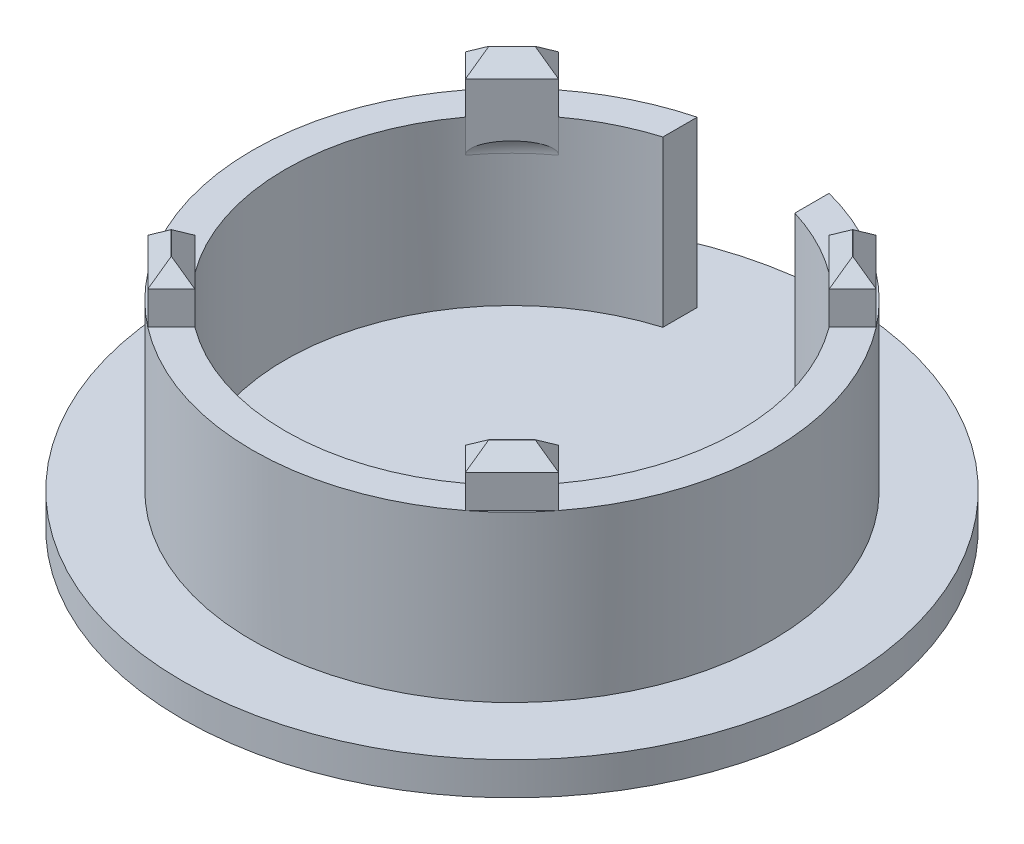
from build123d import *

# Parameters (mm, degrees)
SKETCH1_R           = 20.0025
SKETCH1_R_2         = 17.4625
BOSS_EXTRUDE1_DEPTH = 12.7
BOSS_EXTRUDE2_DEPTH = 3.81
FILLET1_R           = 2.54
CUT_EXTRUDE1_REACH  = 33.008
SKETCH3_W           = 10.16
SKETCH3_H           = 5.08
SKETCH5_R           = 25.4
BOSS_EXTRUDE3_DEPTH = 2.54
CHAMFER1_SIZE       = 1.27
CUT_EXTRUDE2_DEPTH  = 0.635


with BuildPart() as part:
    # Sketch1 → Boss-Extrude1 (new body)
    with BuildSketch(Plane(origin=(0, 0, 0), x_dir=(1, 0, 0), z_dir=(0, 1, 0))):
        with Locations(Location((0, 0, 0), (0, 0, 270))):
            Circle(SKETCH1_R)
        with Locations(Location((0, 0, 0), (0, 0, 270))):
            Circle(SKETCH1_R_2, mode=Mode.SUBTRACT)
    extrude(amount=BOSS_EXTRUDE1_DEPTH)

    # Sketch2 → Boss-Extrude2 (add)
    with BuildSketch(Plane(origin=(0, 12.7, 0), x_dir=(1, 0, 0), z_dir=(0, 1, 0))):
        Polygon((-14.012583184, 10.420480736), (-10.420480736, 14.012583184), (-12.233353721, 15.82545617), (-15.82545617, 12.233353721), align=None)
        Polygon((15.82545617, 12.233353721), (12.233353721, 15.82545617), (10.420480736, 14.012583184), (14.012583184, 10.420480736), align=None)
        Polygon((14.012583184, -10.420480736), (15.82545617, -12.233353721), (12.233353721, -15.82545617), (10.420480736, -14.012583184), align=None)
        Polygon((-10.420480736, -14.012583184), (-12.233353721, -15.82545617), (-15.82545617, -12.233353721), (-14.012583184, -10.420480736), align=None)
    extrude(amount=BOSS_EXTRUDE2_DEPTH)

    # Fillet1
    # the kernel refuses this fillet: 2.54 mm, written as the material it adds along each edge
    with BuildSketch(Plane(origin=(0, 12.7, 0), x_dir=(0.9622119092251143, 0, -0.27230174759879905), z_dir=(0.27230174759879905, 0, 0.9622119092251143))) as fillet1_piece_1_section:
        with BuildLine():
            CenterArc((17.4625 - FILLET1_R, -FILLET1_R), FILLET1_R, 0, 90)
            Line((17.4625 - FILLET1_R, 0), (17.4625, 0))
            Line((17.4625, 0), (17.4625, -FILLET1_R))
        make_face()
    fillet1_piece_1 = revolve(axis=Axis((0, 12.7, 0), (0, 1, 0)), revolution_arc=58.397439468, mode=Mode.PRIVATE)
    fillet1_piece_1 = split(fillet1_piece_1, bisect_by=Plane(origin=(12.216531698, 11.701072116, -12.216532222), z_dir=(0.7071067811865495, 0, -0.7071067811865456)), keep=Keep.TOP, mode=Mode.PRIVATE)
    add(fillet1_piece_1)
    with BuildSketch(Plane(origin=(0, 12.7, 0), x_dir=(0.27230174759880327, 0, 0.9622119092251133), z_dir=(-0.9622119092251133, 0, 0.27230174759880327))) as fillet1_piece_2_section:
        with BuildLine():
            CenterArc((17.4625 - FILLET1_R, -FILLET1_R), FILLET1_R, 0, 90)
            Line((17.4625 - FILLET1_R, 0), (17.4625, 0))
            Line((17.4625, 0), (17.4625, -FILLET1_R))
        make_face()
    fillet1_piece_2 = revolve(axis=Axis((0, 12.7, 0), (0, 1, 0)), revolution_arc=58.397439468, mode=Mode.PRIVATE)
    fillet1_piece_2 = split(fillet1_piece_2, bisect_by=Plane(origin=(12.216532222, 11.701072116, 12.216531698), z_dir=(0.7071067811865495, 0, 0.7071067811865456)), keep=Keep.TOP, mode=Mode.PRIVATE)
    add(fillet1_piece_2)
    with BuildSketch(Plane(origin=(0, 12.7, 0), x_dir=(-0.9622119092251141, 0, 0.2723017475987997), z_dir=(-0.2723017475987997, 0, -0.9622119092251141))) as fillet1_piece_3_section:
        with BuildLine():
            CenterArc((17.4625 - FILLET1_R, -FILLET1_R), FILLET1_R, 0, 90)
            Line((17.4625 - FILLET1_R, 0), (17.4625, 0))
            Line((17.4625, 0), (17.4625, -FILLET1_R))
        make_face()
    fillet1_piece_3 = revolve(axis=Axis((0, 12.7, 0), (0, 1, 0)), revolution_arc=58.397439468, mode=Mode.PRIVATE)
    fillet1_piece_3 = split(fillet1_piece_3, bisect_by=Plane(origin=(-12.216531698, 11.701072116, 12.216532222), z_dir=(-0.7071067811865488, 0, 0.7071067811865464)), keep=Keep.TOP, mode=Mode.PRIVATE)
    add(fillet1_piece_3)
    with BuildSketch(Plane(origin=(0, 12.7, 0), x_dir=(-0.27230174759880277, 0, -0.9622119092251133), z_dir=(0.9622119092251133, 0, -0.27230174759880277))) as fillet1_piece_4_section:
        with BuildLine():
            CenterArc((17.4625 - FILLET1_R, -FILLET1_R), FILLET1_R, 0, 90)
            Line((17.4625 - FILLET1_R, 0), (17.4625, 0))
            Line((17.4625, 0), (17.4625, -FILLET1_R))
        make_face()
    fillet1_piece_4 = revolve(axis=Axis((0, 12.7, 0), (0, 1, 0)), revolution_arc=58.397439468, mode=Mode.PRIVATE)
    fillet1_piece_4 = split(fillet1_piece_4, bisect_by=Plane(origin=(-12.216532222, 11.701072116, -12.216531698), z_dir=(-0.7071067811865489, 0, -0.7071067811865461)), keep=Keep.TOP, mode=Mode.PRIVATE)
    add(fillet1_piece_4)

    # Sketch3 → Cut-Extrude1 (cut, up to next)
    with BuildSketch(Plane(origin=(0, 12.7, 0), x_dir=(1, 0, 0), z_dir=(0, 1, 0)), mode=Mode.PRIVATE) as cut_extrude1_sk1:
        with Locations((0, 17.4625)):
            Rectangle(SKETCH3_W, SKETCH3_H)
    cut_extrude1_tool1 = extrude(cut_extrude1_sk1.sketch, amount=-CUT_EXTRUDE1_REACH, mode=Mode.PRIVATE) & part.part
    add(cut_extrude1_tool1.solids().sort_by_distance((0, 12.7, -17.4625))[0], mode=Mode.SUBTRACT)

    # Sketch5 → Boss-Extrude3 (add)
    with BuildSketch(Plane.XZ):
        with Locations(Location((0, 0, 0), (0, 0, 270))):
            Circle(SKETCH5_R)
    extrude(amount=BOSS_EXTRUDE3_DEPTH)

    # Chamfer1
    chamfer1_edges = [part.edges().sort_by_distance(p)[0] for p in [
        (14.919019677, 16.51, -11.326917228),
        (14.029404946, 16.51, -14.029404946),
        (11.326917228, 16.51, -14.919019677),
        (12.21653196, 16.51, -12.21653196),
        (-14.919019677, 16.51, -11.326917228),
        (-12.21653196, 16.51, -12.21653196),
        (-11.326917228, 16.51, -14.919019677),
        (-14.029404946, 16.51, -14.029404946),
        (12.21653196, 16.51, 12.21653196),
        (11.326917228, 16.51, 14.919019677),
        (14.029404946, 16.51, 14.029404946),
        (14.919019677, 16.51, 11.326917228),
        (-12.21653196, 16.51, 12.21653196),
        (-14.919019677, 16.51, 11.326917228),
        (-14.029404946, 16.51, 14.029404946),
        (-11.326917228, 16.51, 14.919019677),
    ]]
    chamfer(chamfer1_edges, length=CHAMFER1_SIZE)

    # Sketch6 → Cut-Extrude2 (cut)
    # profile 1 of 9: a face of its own
    with BuildSketch(Plane.XZ.offset(2.54)):
        with BuildLine():
            add(Edge.make_bspline(
                [(-17.032499249, 1.319443002), (-17.03403865, 1.389061904), (-17.037061575, 1.525772652), (-17.059184217, 1.725487552), (-17.095406326, 1.915378659), (-17.145156597, 2.095449841), (-17.211366628, 2.265164031), (-17.292045507, 2.424860277), (-17.385797694, 2.575408719), (-17.496159227, 2.713538284), (-17.620162613, 2.840375461), (-17.761611267, 2.949966524), (-17.918509595, 3.043791119), (-18.090284222, 3.121408569), (-18.278741591, 3.180033156), (-18.481079289, 3.225217959), (-18.699659745, 3.25396588), (-18.850505045, 3.258915542), (-18.928463436, 3.261473577)],
                knots=[0, 0, 0, 0, 1.085004295, 2.130624628, 3.127502488, 4.095591988, 5.038265407, 5.961928981, 6.881004956, 7.797361512, 8.712515032, 9.639410376, 10.577828775, 11.556244546, 12.569940987, 13.648583667, 14.78476404, 16, 16, 16, 16], degree=3))
            add(Edge.make_bspline(
                [(-18.928463436, 3.261473577), (-19.009428359, 3.259898161), (-19.171051085, 3.256753306), (-19.412618116, 3.22620294), (-19.651048232, 3.173968594), (-19.886633931, 3.103712378), (-20.114904105, 3.010869486), (-20.330143531, 2.889926916), (-20.535568165, 2.748731127), (-20.657969705, 2.634973073), (-20.7198862, 2.577428862)],
                knots=[0, 0, 0, 0, 0.987469591, 1.971193459, 2.964671202, 3.962631321, 4.967592825, 5.96377071, 6.969978801, 8, 8, 8, 8], degree=3))
            add(Edge.make_bspline(
                [(-20.7198862, 2.577428862), (-20.780569283, 2.504298842), (-20.902901592, 2.356874489), (-21.056113266, 2.109432817), (-21.184605524, 1.839944722), (-21.269821, 1.59822326), (-21.330522265, 1.392288301), (-21.3757325, 1.225752766), (-21.419416187, 1.048315288), (-21.463028712, 0.860236224), (-21.507304921, 0.661632971), (-21.549251866, 0.452310653), (-21.592563156, 0.232674257), (-21.618890889, 0.082223801), (-21.632376037, 0.005162602)],
                knots=[0, 0, 0, 0, 1.236008724, 2.491696123, 3.776879683, 5.116281345, 5.823362495, 6.57201389, 7.362629052, 8.202256904, 9.085583543, 10.011580638, 10.981525319, 12, 12, 12, 12], degree=3))
            add(Edge.make_bspline(
                [(-21.632376037, 0.005162602), (-21.649619068, -0.082948011), (-21.68236184, -0.250261149), (-21.721959716, -0.490586411), (-21.754928731, -0.706017827), (-21.777870881, -0.898946693), (-21.79567817, -1.069722058), (-21.804610384, -1.221794959), (-21.81435313, -1.355064604), (-21.814356289, -1.438200023), (-21.814357745, -1.476504065)],
                knots=[0, 0, 0, 0, 1.44127866, 2.736842362, 3.909953624, 4.939685167, 5.855787046, 6.665763779, 7.385260328, 8, 8, 8, 8], degree=3))
            add(Edge.make_bspline(
                [(-21.814357745, -1.476504065), (-21.812665587, -1.540280885), (-21.809346987, -1.665357723), (-21.782028431, -1.847856866), (-21.742993307, -2.0218846), (-21.686640859, -2.186220068), (-21.617860324, -2.342574851), (-21.52945119, -2.487457156), (-21.429379248, -2.625207301), (-21.312501158, -2.75157707), (-21.182702092, -2.866886697), (-21.037980528, -2.96659435), (-20.880889438, -3.052044478), (-20.711076977, -3.123323554), (-20.528476283, -3.178549507), (-20.333133892, -3.218166493), (-20.125557957, -3.244197572), (-19.98257141, -3.249648153), (-19.909357745, -3.252439024)],
                knots=[0, 0, 0, 0, 1.043586486, 2.046644819, 3.015385727, 3.959777502, 4.886618628, 5.805854748, 6.732802919, 7.669970395, 8.618136816, 9.569645907, 10.540433057, 11.541139376, 12.579411923, 13.658246277, 14.800947521, 16, 16, 16, 16], degree=3))
            add(Edge.make_bspline(
                [(-19.909357745, -3.252439024), (-19.839601295, -3.251429406), (-19.701450676, -3.249429885), (-19.497849111, -3.226568937), (-19.300115063, -3.190716508), (-19.109094414, -3.139395566), (-18.925121719, -3.071495745), (-18.747351629, -2.990243315), (-18.576468668, -2.892878614), (-18.412299902, -2.780388698), (-18.255813402, -2.652784166), (-18.1097056, -2.508650731), (-17.972812259, -2.349061838), (-17.848990483, -2.171406666), (-17.731565928, -1.979893812), (-17.626560778, -1.771438122), (-17.530048885, -1.547541882), (-17.476692785, -1.390437157), (-17.44937807, -1.310010163)],
                knots=[0, 0, 0, 0, 0.989643029, 1.959959244, 2.903686927, 3.839798661, 4.763158309, 5.683889659, 6.610896296, 7.550863383, 8.505471603, 9.472651208, 10.46012564, 11.485097357, 12.542758083, 13.645985729, 14.794903902, 16, 16, 16, 16], degree=3))
            Line((-17.44937807, -1.310010163), (-18.642448247, -1.309011925))
            add(Edge.make_bspline(
                [(-18.642448247, -1.309011925), (-18.6657257, -1.371522969), (-18.711936412, -1.49562073), (-18.807720068, -1.669692017), (-18.923447123, -1.830790799), (-19.036016621, -1.953732199), (-19.135891079, -2.042411814), (-19.216815468, -2.10212279), (-19.304819326, -2.149984803), (-19.397301384, -2.192212411), (-19.495010012, -2.225414007), (-19.59861909, -2.250459008), (-19.707617868, -2.265437385), (-19.782402979, -2.269490608), (-19.820302867, -2.271544715)],
                knots=[0, 0, 0, 0, 1.473040331, 2.924299426, 4.375932429, 5.849949031, 6.597906125, 7.326505657, 8.067354521, 8.808020226, 9.571951013, 10.344710941, 11.161126197, 12, 12, 12, 12], degree=3))
            add(Edge.make_bspline(
                [(-19.820302867, -2.271544715), (-19.879094274, -2.268563702), (-19.993253015, -2.262775293), (-20.155890908, -2.21812569), (-20.301319936, -2.143947436), (-20.429216243, -2.04298274), (-20.533656064, -1.913574185), (-20.609650722, -1.758042242), (-20.656138574, -1.57848147), (-20.663247774, -1.450550674), (-20.666969533, -1.383577236)],
                knots=[0, 0, 0, 0, 1.021781972, 1.984054262, 2.907838959, 3.845226274, 4.797816657, 5.775134162, 6.835253762, 8, 8, 8, 8], degree=3))
            add(Edge.make_bspline(
                [(-20.666969533, -1.383577236), (-20.666094088, -1.339675553), (-20.664255338, -1.247466172), (-20.652658744, -1.102069492), (-20.637746871, -0.942317047), (-20.606967367, -0.705521046), (-20.558582036, -0.387774591), (-20.512660034, -0.128969689), (-20.488859777, 0.005162602)],
                knots=[0, 0, 0, 0, 0.56382053, 1.184226618, 1.872559965, 2.62436128, 4.250488501, 6, 6, 6, 6], degree=3))
            add(Edge.make_bspline(
                [(-20.488859777, 0.005162602), (-20.475745913, 0.075761551), (-20.450366378, 0.212393165), (-20.409954223, 0.409708658), (-20.371552898, 0.59262623), (-20.334033177, 0.761359711), (-20.297318627, 0.915599467), (-20.259046995, 1.05553357), (-20.224056513, 1.181666084), (-20.17666921, 1.325890507), (-20.117704038, 1.484431336), (-20.03882097, 1.650839428), (-19.956192415, 1.79166794), (-19.888178373, 1.867181782), (-19.856441078, 1.902418699)],
                knots=[0, 0, 0, 0, 1.278184275, 2.473696614, 3.585163994, 4.605199634, 5.550637581, 6.407020795, 7.187555592, 7.880188226, 9.109059753, 10.194931009, 11.157703224, 12, 12, 12, 12], degree=3))
            add(Edge.make_bspline(
                [(-19.856441078, 1.902418699), (-19.828885232, 1.930371703), (-19.774100011, 1.985946534), (-19.685839955, 2.060852632), (-19.591104096, 2.124140905), (-19.493111816, 2.181254853), (-19.385850069, 2.225126107), (-19.269523235, 2.257868392), (-19.142491244, 2.277152947), (-19.054153755, 2.279411572), (-19.008483761, 2.280579268)],
                knots=[0, 0, 0, 0, 0.983174765, 1.954701254, 2.893388149, 3.834546902, 4.791313645, 5.787692279, 6.85624912, 8, 8, 8, 8], degree=3))
            add(Edge.make_bspline(
                [(-19.008483761, 2.280579268), (-18.97317018, 2.278991471), (-18.904847202, 2.27591948), (-18.806040372, 2.262248505), (-18.715746638, 2.238149721), (-18.631394825, 2.209860622), (-18.556909583, 2.168160518), (-18.48712561, 2.122884481), (-18.427621146, 2.065716604), (-18.356388414, 1.980983592), (-18.286394988, 1.857389276), (-18.222918672, 1.694200011), (-18.18730805, 1.511994253), (-18.182423782, 1.385015498), (-18.1798862, 1.319044715)],
                knots=[0, 0, 0, 0, 0.884197574, 1.710701972, 2.488615259, 3.220572099, 3.928391824, 4.617974251, 5.295695654, 5.983343529, 7.382521495, 8.82366636, 10.349761621, 12, 12, 12, 12], degree=3))
            Line((-18.1798862, 1.319044715), (-17.032499249, 1.319443002))
        make_face()
    # profile 2 of 9: a face of its own
    with BuildSketch(Plane.XZ.offset(2.54)):
        with BuildLine():
            add(Edge.make_bspline(
                [(-12.798726036, 1.099020331), (-12.830023741, 1.133457931), (-12.891501233, 1.201103058), (-12.994353428, 1.289754914), (-13.104313881, 1.363235244), (-13.22104814, 1.423825646), (-13.347034618, 1.470939289), (-13.483913824, 1.504038453), (-13.632796017, 1.523466548), (-13.73568634, 1.52568691), (-13.789093517, 1.526839431)],
                knots=[0, 0, 0, 0, 0.999027873, 1.962371597, 2.90822252, 3.834131655, 4.781696813, 5.790389215, 6.853059556, 8, 8, 8, 8], degree=3))
            add(Edge.make_bspline(
                [(-13.789093517, 1.526839431), (-13.848969346, 1.524932324), (-13.966644841, 1.521184238), (-14.139887699, 1.496642953), (-14.30496107, 1.453844326), (-14.461769583, 1.395470579), (-14.608056489, 1.323877367), (-14.742786041, 1.239458014), (-14.86363715, 1.141648552), (-14.933044685, 1.066103863), (-14.967457338, 1.028648374)],
                knots=[0, 0, 0, 0, 1.089627513, 2.141472771, 3.176369439, 4.18708497, 5.181476363, 6.135023986, 7.075334216, 8, 8, 8, 8], degree=3))
            Line((-14.967457338, 1.028648374), (-14.868425127, 1.445528455))
            Line((-14.868425127, 1.445528455), (-15.93895914, 1.445528455))
            Line((-15.93895914, 1.445528455), (-16.866755285, -3.169838659))
            Line((-16.866755285, -3.169838659), (-15.760536805, -3.169838659))
            Line((-15.760536805, -3.169838659), (-15.198506448, -0.379538187))
            add(Edge.make_bspline(
                [(-15.198506448, -0.379538187), (-15.182267843, -0.311410241), (-15.150894407, -0.179785155), (-15.075110298, 0.003140452), (-14.978485098, 0.163743108), (-14.86045594, 0.298641657), (-14.727284097, 0.406845111), (-14.581683927, 0.485679853), (-14.425611857, 0.536078636), (-14.317339776, 0.54263846), (-14.262762216, 0.545945122)],
                knots=[0, 0, 0, 0, 1.175922263, 2.27191448, 3.313835039, 4.313297013, 5.270001712, 6.182577354, 7.083877474, 8, 8, 8, 8], degree=3))
            add(Edge.make_bspline(
                [(-14.262762216, 0.545945122), (-14.233877024, 0.544468842), (-14.178263661, 0.541626525), (-14.097923803, 0.52649619), (-14.025389689, 0.499124032), (-13.939373826, 0.450266234), (-13.84480654, 0.372610662), (-13.784410416, 0.29712271), (-13.754245956, 0.259420732)],
                knots=[0, 0, 0, 0, 0.856224582, 1.648510002, 2.41070551, 3.141017598, 4.572099397, 6, 6, 6, 6], degree=3))
            Line((-13.754245956, 0.259420732), (-12.798726036, 1.099020331))
        make_face()
    # profile 3 of 9: a face of its own
    with BuildSketch(Plane.XZ.offset(2.54)):
        with BuildLine():
            add(Edge.make_bspline(
                [(-9.102743151, 0.241925108), (-9.10686809, 0.300357051), (-9.114840181, 0.413285938), (-9.143348745, 0.575733573), (-9.185061644, 0.724594427), (-9.242529791, 0.859414746), (-9.313569412, 0.980467644), (-9.39956456, 1.088022508), (-9.501230031, 1.179892516), (-9.615881798, 1.257360138), (-9.739338979, 1.321116158), (-9.866491552, 1.379126779), (-9.997938354, 1.426075656), (-10.132975555, 1.465990918), (-10.272317631, 1.493004169), (-10.414710534, 1.514726705), (-10.561027676, 1.52478781), (-10.659686652, 1.524436082), (-10.709601647, 1.52425813)],
                knots=[0, 0, 0, 0, 1.207315941, 2.333327297, 3.3947515, 4.38842524, 5.346983082, 6.280835741, 7.216582841, 8.161495329, 9.125906202, 10.078946762, 11.041560492, 12.001841106, 12.979665509, 13.965825615, 14.970840692, 16, 16, 16, 16], degree=3))
            add(Edge.make_bspline(
                [(-10.709601647, 1.52425813), (-10.812924607, 1.521799215), (-11.010126042, 1.517106149), (-11.291348254, 1.488279039), (-11.542800721, 1.439162136), (-11.765383302, 1.368786384), (-11.963108039, 1.28110621), (-12.141128547, 1.178380016), (-12.303271909, 1.06172704), (-12.396705823, 0.969665727), (-12.442945143, 0.924105691)],
                knots=[0, 0, 0, 0, 1.313759801, 2.507432205, 3.58987333, 4.56558695, 5.469239224, 6.334319529, 7.175674787, 8, 8, 8, 8], degree=3))
            Line((-12.442945143, 0.924105691), (-11.877224333, 0.165625486))
            add(Edge.make_bspline(
                [(-11.877224333, 0.165625486), (-11.84741938, 0.199182382), (-11.787659198, 0.266465369), (-11.686844863, 0.357319603), (-11.575040507, 0.435348776), (-11.455586067, 0.505375099), (-11.324455797, 0.561336566), (-11.18112388, 0.600454701), (-11.026815144, 0.627558356), (-10.919671059, 0.630766263), (-10.864479696, 0.632418699)],
                knots=[0, 0, 0, 0, 0.933548371, 1.871803742, 2.815722463, 3.766240912, 4.748971153, 5.772096895, 6.85237705, 8, 8, 8, 8], degree=3))
            add(Edge.make_bspline(
                [(-10.864479696, 0.632418699), (-10.809682037, 0.630026399), (-10.706180864, 0.625507851), (-10.562624428, 0.596800621), (-10.439378096, 0.555598798), (-10.338654277, 0.495497686), (-10.259725305, 0.418856833), (-10.20377746, 0.325643742), (-10.17275201, 0.216170382), (-10.169326185, 0.138727649), (-10.167528476, 0.098089431)],
                knots=[0, 0, 0, 0, 1.319117301, 2.491533204, 3.513947219, 4.434365949, 5.291558987, 6.137342867, 7.022567192, 8, 8, 8, 8], degree=3))
            add(Edge.make_bspline(
                [(-10.167528476, 0.098089431), (-10.167963519, 0.054938602), (-10.168834494, -0.031451284), (-10.185166928, -0.116288214), (-10.193341485, -0.15875)],
                knots=[0, 0, 0, 0, 0.998978727, 2, 2, 2, 2], degree=3))
            Line((-10.193341485, -0.15875), (-10.256655197, -0.454308943))
            Line((-10.256655197, -0.454308943), (-11.379284096, -0.454308943))
            add(Edge.make_bspline(
                [(-11.379284096, -0.454308943), (-11.446946477, -0.454282173), (-11.579128302, -0.454229877), (-11.772476297, -0.476337496), (-11.956632675, -0.510366397), (-12.131394575, -0.560634843), (-12.296545993, -0.626899732), (-12.451915037, -0.708381714), (-12.598067116, -0.805436223), (-12.686359038, -0.881820722), (-12.730760184, -0.92023374)],
                knots=[0, 0, 0, 0, 1.107106851, 2.162788268, 3.181045281, 4.170957246, 5.135065711, 6.089837909, 7.039398146, 8, 8, 8, 8], degree=3))
            add(Edge.make_bspline(
                [(-12.730760184, -0.92023374), (-12.763021699, -0.954358674), (-12.8273037, -1.022353589), (-12.908815434, -1.137789129), (-12.978527184, -1.262062317), (-13.036936521, -1.395498996), (-13.082392985, -1.538672867), (-13.113714057, -1.69143402), (-13.135333107, -1.853632972), (-13.138347688, -1.965156443), (-13.139896363, -2.022449187)],
                knots=[0, 0, 0, 0, 0.932950914, 1.858931622, 2.801328997, 3.76302609, 4.750672469, 5.782683737, 6.860902263, 8, 8, 8, 8], degree=3))
            add(Edge.make_bspline(
                [(-13.139896363, -2.022449187), (-13.138674818, -2.066835741), (-13.136292335, -2.153406685), (-13.117129424, -2.279862961), (-13.089485792, -2.399731761), (-13.050099557, -2.51329973), (-13.00113885, -2.620644113), (-12.941601696, -2.722314053), (-12.869930031, -2.816537908), (-12.789059831, -2.904323145), (-12.698027966, -2.983272583), (-12.599028251, -3.053365064), (-12.490190773, -3.111395398), (-12.374704436, -3.160739112), (-12.250234593, -3.197823471), (-12.118694477, -3.226249279), (-11.978370203, -3.244600822), (-11.881998211, -3.248073123), (-11.832467501, -3.249857724)],
                knots=[0, 0, 0, 0, 1.056708611, 2.060990436, 3.040285684, 3.983310203, 4.918732267, 5.846659338, 6.783259339, 7.733162481, 8.684611978, 9.648342996, 10.615825753, 11.616913472, 12.634748691, 13.704002915, 14.819964546, 16, 16, 16, 16], degree=3))
            add(Edge.make_bspline(
                [(-11.832467501, -3.249857724), (-11.770407773, -3.248198463), (-11.65002719, -3.244979907), (-11.476824465, -3.218113711), (-11.316005925, -3.178818327), (-11.168905707, -3.122837711), (-11.033285107, -3.054797431), (-10.908741912, -2.977561072), (-10.793439829, -2.892453862), (-10.725324877, -2.82768239), (-10.691532541, -2.79554878)],
                knots=[0, 0, 0, 0, 1.180543716, 2.289963953, 3.328651874, 4.326345414, 5.278473564, 6.212435154, 7.113175766, 8, 8, 8, 8], degree=3))
            Line((-10.691532541, -2.79554878), (-10.772702352, -3.169838659))
            Line((-10.772702352, -3.169838659), (-9.72383841, -3.169838659))
            Line((-9.72383841, -3.169838659), (-9.145314448, -0.196797719))
            add(Edge.make_bspline(
                [(-9.145314448, -0.196797719), (-9.133276288, -0.124046547), (-9.109268905, 0.021039188), (-9.105774651, 0.168054864), (-9.104032541, 0.241351626)],
                knots=[0, 0, 0, 0, 1.002871466, 2, 2, 2, 2], degree=3))
            Line((-9.104032541, 0.241351626), (-9.102743151, 0.241925108))
        make_face()
        with BuildLine():
            Line((-10.410563998, -1.187399634), (-10.464884751, -1.461685533))
            add(Edge.make_bspline(
                [(-10.464884751, -1.461685533), (-10.477740777, -1.519591532), (-10.502546686, -1.631322091), (-10.565054124, -1.787018862), (-10.642545171, -1.928114846), (-10.711557151, -2.007600877), (-10.745739858, -2.046971545)],
                knots=[0, 0, 0, 0, 1.080350331, 2.084553364, 3.051249493, 4, 4, 4, 4], degree=3))
            add(Edge.make_bspline(
                [(-10.745739858, -2.046971545), (-10.768356942, -2.07128716), (-10.813108182, -2.119399195), (-10.89097865, -2.179984848), (-10.973336791, -2.232938269), (-11.061969852, -2.278104734), (-11.15802652, -2.310240347), (-11.25948414, -2.337402167), (-11.367889109, -2.351855297), (-11.442229759, -2.355937608), (-11.48011994, -2.358018293)],
                knots=[0, 0, 0, 0, 0.968683297, 1.916682928, 2.871902514, 3.827370091, 4.81310514, 5.825088888, 6.891484338, 8, 8, 8, 8], degree=3))
            add(Edge.make_bspline(
                [(-11.48011994, -2.358018293), (-11.527602122, -2.356418535), (-11.616819328, -2.353412652), (-11.740327744, -2.32807539), (-11.84633837, -2.292741062), (-11.930674949, -2.237969034), (-11.997829382, -2.172866113), (-12.042925541, -2.09479209), (-12.072050664, -2.007691952), (-12.074910262, -1.946120209), (-12.076400428, -1.914034553)],
                knots=[0, 0, 0, 0, 1.356263404, 2.54836715, 3.595430724, 4.530674789, 5.400753975, 6.244865324, 7.085381633, 8, 8, 8, 8], degree=3))
            add(Edge.make_bspline(
                [(-12.076400428, -1.914034553), (-12.073679581, -1.862985983), (-12.068401157, -1.76395207), (-12.02728418, -1.623166862), (-11.960285157, -1.497637293), (-11.867131038, -1.38914644), (-11.749650299, -1.300043986), (-11.60818104, -1.237472461), (-11.446719188, -1.196025412), (-11.331547417, -1.191215971), (-11.271034574, -1.188689024)],
                knots=[0, 0, 0, 0, 1.003565055, 1.94691005, 2.859971103, 3.784892615, 4.7400974, 5.736671384, 6.810815814, 8, 8, 8, 8], degree=3))
            Line((-11.271034574, -1.188689024), (-10.410563998, -1.187399634))
        make_face(mode=Mode.SUBTRACT)
    # profile 4 of 9: a face of its own
    with BuildSketch(Plane.XZ.offset(2.54)):
        with BuildLine():
            add(Edge.make_bspline(
                [(-4.229247216, 0.189714266), (-4.2314554, 0.245704269), (-4.235765157, 0.35498113), (-4.255307597, 0.512381788), (-4.283424887, 0.658797332), (-4.321488826, 0.793044617), (-4.37111951, 0.915764349), (-4.42966411, 1.02661309), (-4.499350873, 1.125643863), (-4.579351227, 1.211845927), (-4.66809691, 1.28629818), (-4.760262995, 1.35267216), (-4.858888175, 1.407213964), (-4.96174191, 1.453045822), (-5.071281993, 1.485887183), (-5.185101825, 1.510795248), (-5.304411507, 1.525248132), (-5.38563027, 1.52630268), (-5.426969533, 1.526839431)],
                knots=[0, 0, 0, 0, 1.321729148, 2.579646463, 3.738370996, 4.837202262, 5.866492573, 6.85658844, 7.78889368, 8.715599772, 9.622919503, 10.518636129, 11.391274208, 12.277738509, 13.170400925, 14.084341243, 15.024955326, 16, 16, 16, 16], degree=3))
            add(Edge.make_bspline(
                [(-5.426969533, 1.526839431), (-5.487313762, 1.525174855), (-5.604705952, 1.52193663), (-5.77357265, 1.494983723), (-5.930521815, 1.456315711), (-6.072663005, 1.398485095), (-6.20106214, 1.329980612), (-6.317523239, 1.254925135), (-6.420513291, 1.171555502), (-6.478719866, 1.107696474), (-6.507243924, 1.076402439)],
                knots=[0, 0, 0, 0, 1.199193345, 2.332881488, 3.393181407, 4.40672087, 5.374946547, 6.283749575, 7.158953685, 8, 8, 8, 8], degree=3))
            Line((-6.507243924, 1.076402439), (-6.086722544, 3.180161341))
            Line((-6.086722544, 3.180161341), (-7.192941024, 3.180161341))
            Line((-7.192941024, 3.180161341), (-8.459739606, -3.169838659))
            Line((-8.459739606, -3.169838659), (-7.389205593, -3.169838659))
            Line((-7.389205593, -3.169838659), (-7.299994426, -2.696284656))
            add(Edge.make_bspline(
                [(-7.299994426, -2.696284656), (-7.27423577, -2.741121958), (-7.22380625, -2.828903077), (-7.124197964, -2.942398104), (-7.011296812, -3.039521917), (-6.880963244, -3.116849923), (-6.737443532, -3.179790926), (-6.577533651, -3.221253406), (-6.404003019, -3.247481499), (-6.283203512, -3.250748933), (-6.220719533, -3.252439024)],
                knots=[0, 0, 0, 0, 0.966451173, 1.892088974, 2.812485316, 3.745356001, 4.719898493, 5.738363444, 6.830160369, 8, 8, 8, 8], degree=3))
            add(Edge.make_bspline(
                [(-6.220719533, -3.252439024), (-6.16387598, -3.251231024), (-6.05200136, -3.24885354), (-5.886555619, -3.229017661), (-5.726628305, -3.195806817), (-5.572652385, -3.148074623), (-5.426647871, -3.086351866), (-5.290010458, -3.010310183), (-5.165199088, -2.917644644), (-5.090284726, -2.846665224), (-5.052680915, -2.811036585)],
                knots=[0, 0, 0, 0, 1.062868591, 2.091847087, 3.111280532, 4.114001345, 5.101858504, 6.070957489, 7.031703028, 8, 8, 8, 8], degree=3))
            add(Edge.make_bspline(
                [(-5.052680915, -2.811036585), (-5.005603472, -2.755780197), (-4.909694134, -2.643208163), (-4.791227042, -2.450279882), (-4.6878838, -2.238309389), (-4.605502249, -2.003528992), (-4.534674802, -1.747930893), (-4.467217347, -1.471717316), (-4.406845313, -1.172794877), (-4.372307397, -0.965518118), (-4.354439045, -0.85828252)],
                knots=[0, 0, 0, 0, 0.827433316, 1.685702862, 2.57510852, 3.51480065, 4.520427527, 5.601780907, 6.759270171, 8, 8, 8, 8], degree=3))
            add(Edge.make_bspline(
                [(-4.354439045, -0.85828252), (-4.344264625, -0.799817294), (-4.324763735, -0.68775942), (-4.301060035, -0.52530305), (-4.277917218, -0.376288689), (-4.262299408, -0.239214485), (-4.246680113, -0.115525525), (-4.238734678, -0.003910171), (-4.230840759, 0.094539723), (-4.230632584, 0.156155441), (-4.230536606, 0.184563008)],
                knots=[0, 0, 0, 0, 1.354785616, 2.596661372, 3.748205583, 4.797158244, 5.746258136, 6.59375987, 7.351661183, 8, 8, 8, 8], degree=3))
            Line((-4.230536606, 0.184563008), (-4.229247216, 0.189714266))
        make_face()
        with BuildLine():
            add(Edge.make_bspline(
                [(-5.292743151, -0.105358162), (-5.29546776, -0.161076404), (-5.301347233, -0.281311588), (-5.326206687, -0.468043783), (-5.355649525, -0.663449276), (-5.380133617, -0.794241571), (-5.392121972, -0.85828252)],
                knots=[0, 0, 0, 0, 0.880298334, 1.899608289, 2.971567261, 4, 4, 4, 4], degree=3))
            add(Edge.make_bspline(
                [(-5.392121972, -0.85828252), (-5.411699492, -0.961864552), (-5.44886488, -1.158501644), (-5.525217607, -1.434474059), (-5.614358372, -1.676007804), (-5.70166121, -1.854447159), (-5.781208473, -1.977456239), (-5.849876208, -2.054251215), (-5.92448878, -2.121582568), (-6.010032057, -2.174133787), (-6.102055809, -2.21728362), (-6.202668044, -2.248688366), (-6.311767162, -2.26611263), (-6.387155281, -2.269699648), (-6.425932948, -2.271544715)],
                knots=[0, 0, 0, 0, 1.969278136, 3.738419877, 5.343680255, 6.774639469, 7.441334667, 8.07359752, 8.694513789, 9.312351675, 9.941797058, 10.590209687, 11.274840928, 12, 12, 12, 12], degree=3))
            add(Edge.make_bspline(
                [(-6.425932948, -2.271544715), (-6.453951852, -2.269927796), (-6.508113883, -2.266802206), (-6.584954386, -2.253724203), (-6.654755057, -2.235852379), (-6.71705946, -2.211660035), (-6.7715731, -2.180391425), (-6.819106188, -2.144067223), (-6.858655087, -2.10088686), (-6.898506288, -2.034907739), (-6.93781363, -1.948129483), (-6.969856565, -1.840346929), (-6.98951079, -1.730629227), (-6.988942237, -1.656844802), (-6.988656525, -1.61976626)],
                knots=[0, 0, 0, 0, 1.025434696, 1.9822198, 2.844474919, 3.656486362, 4.417375653, 5.134748957, 5.836254221, 6.543205082, 7.943921235, 9.307402385, 10.64690153, 12, 12, 12, 12], degree=3))
            add(Edge.make_bspline(
                [(-6.988656525, -1.61976626), (-6.986433241, -1.563346095), (-6.981632774, -1.441524871), (-6.95687105, -1.252258156), (-6.925157705, -1.055084318), (-6.901905418, -0.922791427), (-6.890567094, -0.85828252)],
                knots=[0, 0, 0, 0, 0.881249986, 1.9027763, 2.977347866, 4, 4, 4, 4], degree=3))
            add(Edge.make_bspline(
                [(-6.890567094, -0.85828252), (-6.880565105, -0.805299777), (-6.861075234, -0.702057634), (-6.827132982, -0.551929144), (-6.79158398, -0.410045754), (-6.752025263, -0.277215076), (-6.707373318, -0.154031476), (-6.66141178, -0.038636897), (-6.611305716, 0.067747705), (-6.558519782, 0.166099655), (-6.499676344, 0.254487968), (-6.432022172, 0.331365827), (-6.356383597, 0.397054958), (-6.271761809, 0.450190522), (-6.178970937, 0.491320198), (-6.078787802, 0.523208549), (-5.969615557, 0.540480299), (-5.894237803, 0.544088935), (-5.855465468, 0.545945122)],
                knots=[0, 0, 0, 0, 1.348051246, 2.626811845, 3.847803765, 5.004859053, 6.090241142, 7.122960281, 8.109433796, 9.028881994, 9.911997235, 10.757971757, 11.581700865, 12.408374626, 13.246102246, 14.113685344, 15.029729334, 16, 16, 16, 16], degree=3))
            add(Edge.make_bspline(
                [(-5.855465468, 0.545945122), (-5.827438929, 0.544371563), (-5.773686098, 0.541353593), (-5.696947339, 0.527772468), (-5.627041046, 0.510444928), (-5.564578946, 0.486388189), (-5.510845434, 0.454462367), (-5.463590753, 0.418085453), (-5.422673607, 0.375743534), (-5.382987871, 0.309197699), (-5.343980377, 0.222885248), (-5.310722996, 0.115402509), (-5.293725582, 0.005297437), (-5.293930208, -0.068784736), (-5.294032541, -0.105833333)],
                knots=[0, 0, 0, 0, 1.025882494, 1.967566761, 2.845422086, 3.657788127, 4.405387509, 5.123074082, 5.835566233, 6.542825813, 7.944153645, 9.293170194, 10.646310645, 12, 12, 12, 12], degree=3))
            Line((-5.294032541, -0.105833333), (-5.292743151, -0.105358162))
        make_face(mode=Mode.SUBTRACT)
    # profile 5 of 9: a face of its own
    with BuildSketch(Plane.XZ.offset(2.54)):
        Polygon((4.394040633, 3.180161341), (3.145084285, 3.180161341), (1.432229864, -0.877759494), (1.119990777, 3.180161341), (0.236800216, 3.180161341), (-1.690161007, -0.877759494), (-1.832898875, 3.180161341), (-3.046170757, 3.180161341), (-2.671483852, -3.169838659), (-1.690161007, -3.169838659), (0.236800216, 0.736506377), (0.566881537, -3.169838659), (1.557125499, -3.169838659), align=None)
    # profile 6 of 9: a face of its own
    with BuildSketch(Plane.XZ.offset(2.54)):
        with BuildLine():
            add(Edge.make_bspline(
                [(7.830590182, -0.0056592), (7.826709932, 0.058678063), (7.819166197, 0.183758466), (7.794128126, 0.364678351), (7.753989529, 0.531827782), (7.70144431, 0.685826406), (7.633759242, 0.825866629), (7.553942737, 0.953673985), (7.459013744, 1.066829003), (7.350747814, 1.16460402), (7.234790463, 1.250619092), (7.113338816, 1.325575848), (6.987383236, 1.389298472), (6.85673459, 1.441619169), (6.72055113, 1.479334696), (6.58103946, 1.508727585), (6.436595411, 1.523800773), (6.339059216, 1.525816402), (6.289554857, 1.526839431)],
                knots=[0, 0, 0, 0, 1.263483727, 2.456384502, 3.575488201, 4.629198462, 5.640283032, 6.618461667, 7.57642858, 8.52570331, 9.472125555, 10.403810844, 11.32048349, 12.236806786, 13.157931674, 14.087629284, 15.029378928, 16, 16, 16, 16], degree=3))
            add(Edge.make_bspline(
                [(6.289554857, 1.526839431), (6.216354467, 1.523971908), (6.072967118, 1.518354908), (5.863771418, 1.493162953), (5.666504787, 1.450198141), (5.480347006, 1.392373966), (5.306390533, 1.317291358), (5.143259507, 1.227906281), (4.992347989, 1.121966825), (4.902110292, 1.039139938), (4.856932906, 0.997672764)],
                knots=[0, 0, 0, 0, 1.122650337, 2.199084668, 3.224813801, 4.213430669, 5.182386746, 6.123959402, 7.060762695, 8, 8, 8, 8], degree=3))
            add(Edge.make_bspline(
                [(4.856932906, 0.997672764), (4.809360452, 0.949179786), (4.712936811, 0.850890354), (4.586506793, 0.682238013), (4.473415931, 0.495941632), (4.370437477, 0.289123588), (4.279781451, 0.053372468), (4.196985374, -0.216821243), (4.120003381, -0.524610068), (4.076013784, -0.74321113), (4.052857702, -0.85828252)],
                knots=[0, 0, 0, 0, 0.792196638, 1.605687277, 2.453108358, 3.333410481, 4.298535546, 5.397602693, 6.630100545, 8, 8, 8, 8], degree=3))
            add(Edge.make_bspline(
                [(4.052857702, -0.85828252), (4.041718472, -0.919741933), (4.017481266, -1.053467897), (3.987936409, -1.265155372), (3.963426858, -1.490615957), (3.959353376, -1.643795282), (3.957349572, -1.719146341)],
                knots=[0, 0, 0, 0, 0.864226165, 1.880419496, 2.957348602, 4, 4, 4, 4], degree=3))
            add(Edge.make_bspline(
                [(3.957349572, -1.719146341), (3.960490224, -1.783783592), (3.966567722, -1.908863578), (3.994416132, -2.089274418), (4.034032375, -2.256521699), (4.086387142, -2.410998714), (4.153595394, -2.551682605), (4.23581844, -2.677834292), (4.330556596, -2.791126212), (4.438149208, -2.89070885), (4.555667065, -2.975739239), (4.677415625, -3.051489674), (4.803847682, -3.115006398), (4.935600035, -3.16521515), (5.071373044, -3.205622043), (5.212541742, -3.234274654), (5.358657241, -3.249376741), (5.457483887, -3.251411079), (5.507420711, -3.252439024)],
                knots=[0, 0, 0, 0, 1.263673727, 2.445343658, 3.560566728, 4.618566907, 5.626145418, 6.598391793, 7.553036839, 8.504716681, 9.454612957, 10.383067514, 11.304072156, 12.214156399, 13.134431927, 14.069143882, 15.024343878, 16, 16, 16, 16], degree=3))
            add(Edge.make_bspline(
                [(5.507420711, -3.252439024), (5.580197044, -3.249592388), (5.722738714, -3.244016889), (5.930987648, -3.218488189), (6.128188426, -3.176288447), (6.313150978, -3.116250621), (6.487377887, -3.043014476), (6.649998146, -2.953063976), (6.802042609, -2.847657826), (6.893149921, -2.764763559), (6.938752011, -2.723272358)],
                knots=[0, 0, 0, 0, 1.11738205, 2.188534322, 3.215473879, 4.20725923, 5.168692527, 6.111376298, 7.054684126, 8, 8, 8, 8], degree=3))
            add(Edge.make_bspline(
                [(6.938752011, -2.723272358), (6.986000684, -2.674844339), (7.082038367, -2.576409517), (7.205594036, -2.406408545), (7.320646613, -2.221240073), (7.403268756, -2.051823636), (7.464612359, -1.905051493), (7.509793494, -1.784190078), (7.551719433, -1.652839478), (7.594900483, -1.512967666), (7.634136599, -1.362862786), (7.673580118, -1.203911758), (7.708886334, -1.034422955), (7.732153706, -0.918097469), (7.744117865, -0.85828252)],
                knots=[0, 0, 0, 0, 1.178468545, 2.395355919, 3.65506094, 4.977010942, 5.676463195, 6.428984481, 7.226143907, 8.080557606, 8.98137272, 9.931214851, 10.936223839, 12, 12, 12, 12], degree=3))
            add(Edge.make_bspline(
                [(7.744117865, -0.85828252), (7.753323331, -0.798075705), (7.773417474, -0.666653317), (7.801338947, -0.458229118), (7.824594, -0.234515188), (7.827745782, -0.08179939), (7.829300792, -0.006453252)],
                knots=[0, 0, 0, 0, 0.852903718, 1.861760037, 2.945046126, 4, 4, 4, 4], degree=3))
            Line((7.829300792, -0.006453252), (7.830590182, -0.0056592))
        make_face()
        with BuildLine():
            add(Edge.make_bspline(
                [(6.767094247, -0.132548788), (6.767213272, -0.14644666), (6.76749092, -0.178865897), (6.764638751, -0.23457575), (6.75788821, -0.304286586), (6.747384452, -0.388182492), (6.733198387, -0.485862241), (6.714721058, -0.597662727), (6.693075694, -0.723345097), (6.676443605, -0.81184145), (6.667715426, -0.85828252)],
                knots=[0, 0, 0, 0, 0.454706403, 1.060682861, 1.824106415, 2.746032421, 3.827052117, 5.053632861, 6.453806985, 8, 8, 8, 8], degree=3))
            add(Edge.make_bspline(
                [(6.667715426, -0.85828252), (6.655099014, -0.927696523), (6.630762024, -1.061595762), (6.58406803, -1.252299408), (6.53276597, -1.426053031), (6.476070516, -1.582579327), (6.415097956, -1.722770441), (6.34647333, -1.844446099), (6.273424219, -1.94969297), (6.217167878, -2.008452264), (6.190174776, -2.036646341)],
                knots=[0, 0, 0, 0, 1.311915745, 2.530678429, 3.649639997, 4.679855604, 5.625531391, 6.488996717, 7.274985429, 8, 8, 8, 8], degree=3))
            add(Edge.make_bspline(
                [(6.190174776, -2.036646341), (6.151919642, -2.07156485), (6.076000002, -2.140862754), (5.936719276, -2.214062785), (5.781295865, -2.260030904), (5.671233639, -2.267630465), (5.614544694, -2.271544715)],
                knots=[0, 0, 0, 0, 0.971668218, 1.928334723, 2.932962539, 4, 4, 4, 4], degree=3))
            add(Edge.make_bspline(
                [(5.614544694, -2.271544715), (5.572142802, -2.269867589), (5.490290301, -2.266630069), (5.374376659, -2.233004051), (5.271452361, -2.179707821), (5.182972192, -2.104118979), (5.11021057, -2.006985644), (5.061328823, -1.886030394), (5.028091785, -1.746285707), (5.02419624, -1.645801629), (5.022136158, -1.592662602)],
                knots=[0, 0, 0, 0, 0.995315811, 1.921355, 2.813351832, 3.703796515, 4.637110106, 5.639299797, 6.751590143, 8, 8, 8, 8], degree=3))
            add(Edge.make_bspline(
                [(5.022136158, -1.592662602), (5.021484956, -1.578464941), (5.019964986, -1.545326215), (5.023555951, -1.488452243), (5.029539071, -1.417330643), (5.042657833, -1.332903883), (5.054278699, -1.233599371), (5.073127225, -1.121032005), (5.094974811, -0.994102838), (5.11151099, -0.905157098), (5.120225589, -0.85828252)],
                knots=[0, 0, 0, 0, 0.459386587, 1.072253149, 1.840702028, 2.767552715, 3.834163463, 5.074031068, 6.458008685, 8, 8, 8, 8], degree=3))
            add(Edge.make_bspline(
                [(5.120225589, -0.85828252), (5.133249709, -0.789714403), (5.158446486, -0.657060873), (5.206828429, -0.468341925), (5.257365905, -0.295378348), (5.315572322, -0.140894577), (5.377502319, -0.002588472), (5.443956423, 0.118822154), (5.515821921, 0.224003454), (5.571210644, 0.282838733), (5.597766239, 0.311046748)],
                knots=[0, 0, 0, 0, 1.307711683, 2.529930493, 3.649749172, 4.683094642, 5.621309233, 6.487464509, 7.274829267, 8, 8, 8, 8], degree=3))
            add(Edge.make_bspline(
                [(5.597766239, 0.311046748), (5.636921404, 0.345946462), (5.714422502, 0.415024604), (5.854420331, 0.487950373), (6.008760422, 0.53437981), (6.117560071, 0.542022747), (6.17339632, 0.545945122)],
                knots=[0, 0, 0, 0, 0.985193493, 1.950025652, 2.9479481, 4, 4, 4, 4], degree=3))
            add(Edge.make_bspline(
                [(6.17339632, 0.545945122), (6.21577535, 0.544154878), (6.297468118, 0.540703878), (6.413391554, 0.508732073), (6.516829319, 0.456857233), (6.604580506, 0.38115206), (6.677773162, 0.284834756), (6.728796435, 0.164395006), (6.75931426, 0.022574338), (6.76355336, -0.078992281), (6.765804857, -0.132936992)],
                knots=[0, 0, 0, 0, 0.993284727, 1.91472481, 2.800246321, 3.688873924, 4.612194838, 5.616361703, 6.733986801, 8, 8, 8, 8], degree=3))
            Line((6.765804857, -0.132936992), (6.767094247, -0.132548788))
        make_face(mode=Mode.SUBTRACT)
    # profile 7 of 9: a face of its own
    with BuildSketch(Plane.XZ.offset(2.54)):
        with BuildLine():
            add(Edge.make_bspline(
                [(12.477371525, 1.099020331), (12.44607382, 1.133457931), (12.384596328, 1.201103058), (12.281744133, 1.289754914), (12.17178368, 1.363235244), (12.055049421, 1.423825646), (11.929062943, 1.470939289), (11.792183737, 1.504038453), (11.643301544, 1.523466548), (11.540411221, 1.52568691), (11.487004044, 1.526839431)],
                knots=[0, 0, 0, 0, 0.999027873, 1.962371597, 2.90822252, 3.834131655, 4.781696813, 5.790389215, 6.853059556, 8, 8, 8, 8], degree=3))
            add(Edge.make_bspline(
                [(11.487004044, 1.526839431), (11.427128215, 1.524932324), (11.30945272, 1.521184238), (11.136209862, 1.496642953), (10.971136491, 1.453844326), (10.814327978, 1.395470579), (10.668041072, 1.323877367), (10.53331152, 1.239458014), (10.412460411, 1.141648552), (10.343052876, 1.066103863), (10.308640223, 1.028648374)],
                knots=[0, 0, 0, 0, 1.089627513, 2.141472771, 3.176369439, 4.18708497, 5.181476363, 6.135023986, 7.075334216, 8, 8, 8, 8], degree=3))
            Line((10.308640223, 1.028648374), (10.407672433, 1.445528455))
            Line((10.407672433, 1.445528455), (9.337138421, 1.445528455))
            Line((9.337138421, 1.445528455), (8.409342276, -3.169838659))
            Line((8.409342276, -3.169838659), (9.515560756, -3.169838659))
            Line((9.515560756, -3.169838659), (10.077591113, -0.379538187))
            add(Edge.make_bspline(
                [(10.077591113, -0.379538187), (10.093829718, -0.311410241), (10.125203154, -0.179785155), (10.200987263, 0.003140452), (10.297612463, 0.163743108), (10.415641621, 0.298641657), (10.548813464, 0.406845111), (10.694413634, 0.485679853), (10.850485704, 0.536078636), (10.958757785, 0.54263846), (11.013335345, 0.545945122)],
                knots=[0, 0, 0, 0, 1.175922263, 2.27191448, 3.313835039, 4.313297013, 5.270001712, 6.182577354, 7.083877474, 8, 8, 8, 8], degree=3))
            add(Edge.make_bspline(
                [(11.013335345, 0.545945122), (11.042220537, 0.544468842), (11.0978339, 0.541626525), (11.178173758, 0.52649619), (11.250707872, 0.499124032), (11.336723735, 0.450266234), (11.431291021, 0.372610662), (11.491687145, 0.29712271), (11.521851605, 0.259420732)],
                knots=[0, 0, 0, 0, 0.856224582, 1.648510002, 2.41070551, 3.141017598, 4.572099397, 6, 6, 6, 6], degree=3))
            Line((11.521851605, 0.259420732), (12.477371525, 1.099020331))
        make_face()
    # profile 8 of 9: a face of its own
    with BuildSketch(Plane.XZ.offset(2.54)):
        Polygon((17.017499014, 1.445528455), (15.706094848, 1.445528455), (13.868344793, -0.432686768), (14.582034135, 3.180161341), (13.475815655, 3.180161341), (12.209017073, -3.169838659), (13.315235553, -3.169838659), (13.60071129, -1.743685084), (14.234110581, -1.1590507), (15.03701109, -3.169838659), (16.303809672, -3.169838659), (15.072695557, -0.476977251), align=None)
    # profile 9 of 9: a face of its own
    with BuildSketch(Plane.XZ.offset(2.54)):
        with BuildLine():
            add(Edge.make_bspline(
                [(20.937161445, 0.965271641), (20.887333566, 1.012439847), (20.788978977, 1.105544541), (20.626819131, 1.224692712), (20.455173274, 1.322368487), (20.273411098, 1.398909803), (20.080560673, 1.457716744), (19.873619223, 1.496363876), (19.653174841, 1.522107514), (19.501161068, 1.523529158), (19.423213394, 1.52425813)],
                knots=[0, 0, 0, 0, 0.990476806, 1.95508902, 2.898648787, 3.837139202, 4.798542584, 5.805339407, 6.874650071, 8, 8, 8, 8], degree=3))
            add(Edge.make_bspline(
                [(19.423213394, 1.52425813), (19.339673608, 1.522581196), (19.177768685, 1.5193312), (18.943541209, 1.492729586), (18.725221315, 1.452410028), (18.523089865, 1.39405766), (18.336396567, 1.320911726), (18.16582934, 1.231646787), (18.011597135, 1.125605446), (17.921663147, 1.041840367), (17.877014207, 1.000254065)],
                knots=[0, 0, 0, 0, 1.196546223, 2.318975613, 3.373103512, 4.373854808, 5.328440854, 6.241051031, 7.126746078, 8, 8, 8, 8], degree=3))
            add(Edge.make_bspline(
                [(17.877014207, 1.000254065), (17.840775538, 0.960592013), (17.768670418, 0.881675288), (17.677859614, 0.749765087), (17.597460729, 0.611094432), (17.534268241, 0.462889153), (17.482871659, 0.308977854), (17.449378999, 0.149932288), (17.425907714, -0.012217648), (17.422920106, -0.121666472), (17.421414613, -0.176819106)],
                knots=[0, 0, 0, 0, 0.995715573, 1.981203895, 2.964361841, 3.965342833, 4.964954297, 5.970159458, 6.977137917, 8, 8, 8, 8], degree=3))
            add(Edge.make_bspline(
                [(17.421414613, -0.176819106), (17.423253568, -0.234258877), (17.426939429, -0.349386776), (17.469620421, -0.51968001), (17.545651219, -0.682877293), (17.631412681, -0.812473373), (17.717858506, -0.909903127), (17.795617102, -0.978080523), (17.884502171, -1.040449381), (17.984482379, -1.097096197), (18.09569545, -1.148821066), (18.218827468, -1.193736584), (18.353149945, -1.232118096), (18.44693024, -1.252861817), (18.495235751, -1.263546748)],
                knots=[0, 0, 0, 0, 1.232447543, 2.470223941, 3.740378891, 5.086589921, 5.793725457, 6.533875665, 7.303411182, 8.123336115, 9.000234869, 9.936258175, 10.936982395, 12, 12, 12, 12], degree=3))
            Line((18.495235751, -1.263546748), (19.120108431, -1.363536863))
            add(Edge.make_bspline(
                [(19.120108431, -1.363536863), (19.15328135, -1.369673961), (19.216445492, -1.381359532), (19.305143354, -1.406549443), (19.381815822, -1.440346259), (19.448355357, -1.480291497), (19.503775251, -1.531021469), (19.541212573, -1.596982656), (19.565653449, -1.674435553), (19.567873833, -1.730549006), (19.569056889, -1.760447154)],
                knots=[0, 0, 0, 0, 1.215265838, 2.313972577, 3.313390158, 4.225312325, 5.10244974, 5.985048836, 6.926401658, 8, 8, 8, 8], degree=3))
            add(Edge.make_bspline(
                [(19.569056889, -1.760447154), (19.566544303, -1.797514852), (19.561471861, -1.8723476), (19.511198617, -1.979606733), (19.433053373, -2.079454898), (19.325703484, -2.173023883), (19.187275573, -2.253578261), (19.016787063, -2.311470253), (18.816439987, -2.348736683), (18.672670573, -2.354787517), (18.595906483, -2.358018293)],
                knots=[0, 0, 0, 0, 0.703983689, 1.421211398, 2.217979514, 3.114286018, 4.122929777, 5.255582359, 6.534648512, 8, 8, 8, 8], degree=3))
            add(Edge.make_bspline(
                [(18.595906483, -2.358018293), (18.53514443, -2.356291544), (18.418686717, -2.352982025), (18.252685395, -2.327841266), (18.102684635, -2.290348234), (17.969391227, -2.2353073), (17.850297624, -2.166582634), (17.741864049, -2.088184603), (17.643707101, -1.998646911), (17.58759289, -1.931070359), (17.559514207, -1.897256098)],
                knots=[0, 0, 0, 0, 1.237910058, 2.372602124, 3.414750775, 4.382014816, 5.301057057, 6.211356724, 7.104990554, 8, 8, 8, 8], degree=3))
            Line((17.559514207, -1.897256098), (16.771462479, -2.592924229))
            add(Edge.make_bspline(
                [(16.771462479, -2.592924229), (16.822961599, -2.644241936), (16.92615411, -2.747070934), (17.103933885, -2.87618623), (17.294657607, -2.98952782), (17.501401725, -3.084763987), (17.727400084, -3.1586769), (17.973609881, -3.210577345), (18.240968457, -3.243290275), (18.426301409, -3.247616111), (18.52233941, -3.249857724)],
                knots=[0, 0, 0, 0, 0.905420592, 1.814256675, 2.730677759, 3.669317585, 4.646537736, 5.689344974, 6.802637691, 8, 8, 8, 8], degree=3))
            add(Edge.make_bspline(
                [(18.52233941, -3.249857724), (18.600241423, -3.248584952), (18.754567771, -3.246063552), (18.984075457, -3.226887518), (19.208981213, -3.191398577), (19.428191437, -3.143797739), (19.63657417, -3.079641247), (19.826880511, -2.99535676), (19.999848519, -2.895124334), (20.099318693, -2.811253792), (20.148558922, -2.769735772)],
                knots=[0, 0, 0, 0, 1.079038709, 2.137609773, 3.186931524, 4.23082425, 5.242935096, 6.200765537, 7.109333842, 8, 8, 8, 8], degree=3))
            add(Edge.make_bspline(
                [(20.148558922, -2.769735772), (20.184634168, -2.734773077), (20.256780685, -2.664851539), (20.350378075, -2.546895006), (20.432072233, -2.420276371), (20.504210767, -2.286008923), (20.560772452, -2.140879728), (20.602601593, -1.986083605), (20.626728779, -1.820981367), (20.631431341, -1.707606011), (20.633843475, -1.64945122)],
                knots=[0, 0, 0, 0, 0.958453724, 1.916801831, 2.866946689, 3.833393508, 4.821897683, 5.83417994, 6.889063574, 8, 8, 8, 8], degree=3))
            add(Edge.make_bspline(
                [(20.633843475, -1.64945122), (20.633583789, -1.608554024), (20.63307717, -1.528767969), (20.622249039, -1.411926606), (20.605149077, -1.300721454), (20.576988667, -1.195847252), (20.544095783, -1.095604214), (20.5016714, -1.001028869), (20.448967127, -0.91350249), (20.39147684, -0.829375272), (20.322120061, -0.753079151), (20.243313716, -0.682826403), (20.152497025, -0.620874443), (20.05204102, -0.563396109), (19.939067506, -0.515910344), (19.817323541, -0.470786484), (19.683657301, -0.43516745), (19.590258087, -0.417159174), (19.541953231, -0.407845528)],
                knots=[0, 0, 0, 0, 1.066861087, 2.081331876, 3.059618574, 3.999123586, 4.911605908, 5.811078439, 6.696852259, 7.575266237, 8.465724096, 9.380414151, 10.324136264, 11.329620422, 12.395535815, 13.517849507, 14.716264122, 16, 16, 16, 16], degree=3))
            Line((19.541953231, -0.407845528), (18.927180143, -0.305430402))
            add(Edge.make_bspline(
                [(18.927180143, -0.305430402), (18.892340913, -0.299825662), (18.826975734, -0.289310079), (18.736034588, -0.263890006), (18.659646053, -0.229086932), (18.596215577, -0.187924044), (18.546597576, -0.138926131), (18.510718106, -0.082225154), (18.48922042, -0.016974076), (18.487230472, 0.029090436), (18.486201198, 0.052916667)],
                knots=[0, 0, 0, 0, 1.348876944, 2.530755755, 3.598204584, 4.547273339, 5.408113934, 6.243423536, 7.091435138, 8, 8, 8, 8], degree=3))
            add(Edge.make_bspline(
                [(18.486201198, 0.052916667), (18.488203405, 0.09024174), (18.492197752, 0.164704215), (18.531973482, 0.271350234), (18.59650086, 0.369696274), (18.686457309, 0.459285693), (18.805075738, 0.535119598), (18.952744937, 0.589619952), (19.127856147, 0.62395909), (19.253962059, 0.629475272), (19.321252011, 0.632418699)],
                knots=[0, 0, 0, 0, 0.787509793, 1.571059971, 2.374367933, 3.263070351, 4.23819551, 5.330812466, 6.575724956, 8, 8, 8, 8], degree=3))
            add(Edge.make_bspline(
                [(19.321252011, 0.632418699), (19.363020129, 0.63139286), (19.445985209, 0.62935521), (19.568896033, 0.614067958), (19.688041239, 0.585806821), (19.804173162, 0.551108662), (19.91386279, 0.502854338), (20.016568111, 0.444980596), (20.110786671, 0.375131592), (20.165170624, 0.319555296), (20.192441036, 0.291686992)],
                knots=[0, 0, 0, 0, 1.041656087, 2.069068155, 3.081581226, 4.092899725, 5.087575065, 6.063084282, 7.028748603, 8, 8, 8, 8], degree=3))
            Line((20.192441036, 0.291686992), (20.937161445, 0.965271641))
        make_face()
    extrude(amount=-CUT_EXTRUDE2_DEPTH, mode=Mode.SUBTRACT)


solid = part.part
